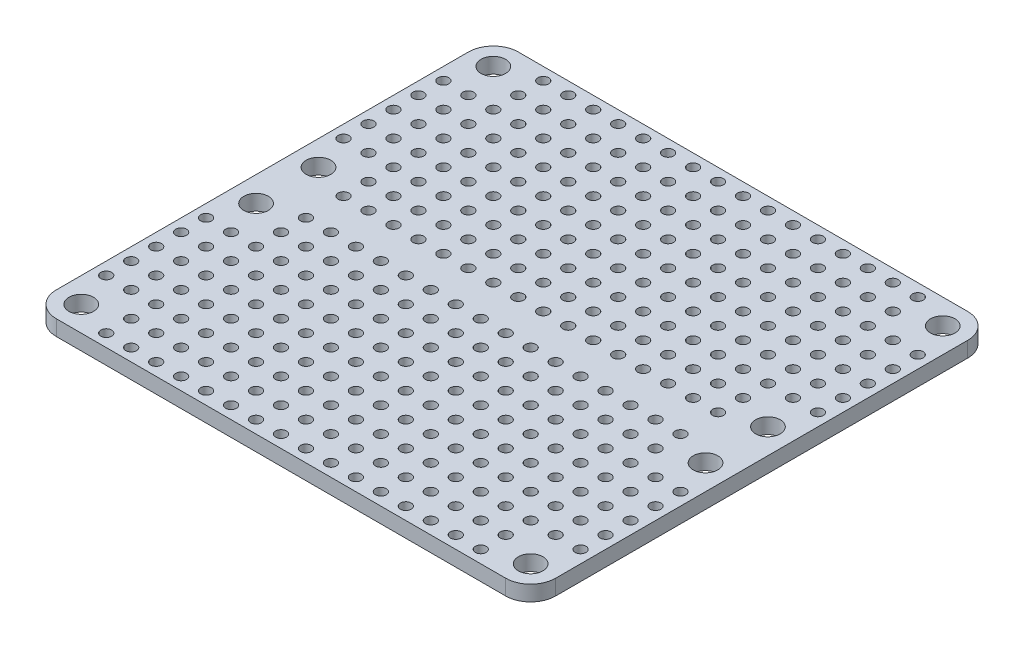
from build123d import *

# Parameters (mm, degrees)
SKETCH1_W               = 50.8
SKETCH1_H               = 47
SKETCH1_R               = 1.25
BOSS_EXTRUDE1_DEPTH     = 1.57
SKETCH4_R               = 0.55
CUT_EXTRUDE2_DEPTH      = 70.225030878
MIRROR2_COPY_1_SKETCH_R = 0.55
MIRROR2_COPY_1_DEPTH    = 70.225030878
FILLET1_R               = 2.54


with BuildPart() as part:
    # Sketch1 → Boss-Extrude1 (new body)
    with BuildSketch(Plane(origin=(0, 0, 0), x_dir=(1, 0, 0), z_dir=(0, 1, 0))):
        with Locations((25.4, 23.5)):
            Rectangle(SKETCH1_W, SKETCH1_H)
        with Locations((2.54, 44.46)):
            Circle(SKETCH1_R, mode=Mode.SUBTRACT)
        with Locations((2.54, 26.675)):
            Circle(SKETCH1_R, mode=Mode.SUBTRACT)
        with Locations((48.26, 26.675)):
            Circle(SKETCH1_R, mode=Mode.SUBTRACT)
        with Locations((48.26, 44.46)):
            Circle(SKETCH1_R, mode=Mode.SUBTRACT)
        with Locations((48.26, 20.325)):
            Circle(SKETCH1_R, mode=Mode.SUBTRACT)
        with Locations((48.26, 2.54)):
            Circle(SKETCH1_R, mode=Mode.SUBTRACT)
        with Locations((2.54, 2.54)):
            Circle(SKETCH1_R, mode=Mode.SUBTRACT)
        with Locations((2.54, 20.325)):
            Circle(SKETCH1_R, mode=Mode.SUBTRACT)
    extrude(amount=BOSS_EXTRUDE1_DEPTH)

    # Sketch4 → Cut-Extrude2 (cut, through all)
    with BuildSketch(Plane(origin=(0, 0, 0), x_dir=(1, 0, 0), z_dir=(0, 1, 0))):
        with Locations((6.35, 45.73)):
            Circle(SKETCH4_R)
        with Locations((8.89, 45.73)):
            Circle(SKETCH4_R)
        with Locations((11.43, 45.73)):
            Circle(SKETCH4_R)
        with Locations((13.97, 45.73)):
            Circle(SKETCH4_R)
        with Locations((16.51, 45.73)):
            Circle(SKETCH4_R)
        with Locations((19.05, 45.73)):
            Circle(SKETCH4_R)
        with Locations((21.59, 45.73)):
            Circle(SKETCH4_R)
        with Locations((24.13, 45.73)):
            Circle(SKETCH4_R)
        with Locations((6.35, 43.19)):
            Circle(SKETCH4_R)
        with Locations((8.89, 43.19)):
            Circle(SKETCH4_R)
        with Locations((11.43, 43.19)):
            Circle(SKETCH4_R)
        with Locations((13.97, 43.19)):
            Circle(SKETCH4_R)
        with Locations((16.51, 43.19)):
            Circle(SKETCH4_R)
        with Locations((19.05, 43.19)):
            Circle(SKETCH4_R)
        with Locations((21.59, 43.19)):
            Circle(SKETCH4_R)
        with Locations((24.13, 43.19)):
            Circle(SKETCH4_R)
        with Locations((6.35, 40.65)):
            Circle(SKETCH4_R)
        with Locations((8.89, 40.65)):
            Circle(SKETCH4_R)
        with Locations((11.43, 40.65)):
            Circle(SKETCH4_R)
        with Locations((13.97, 40.65)):
            Circle(SKETCH4_R)
        with Locations((16.51, 40.65)):
            Circle(SKETCH4_R)
        with Locations((19.05, 40.65)):
            Circle(SKETCH4_R)
        with Locations((21.59, 40.65)):
            Circle(SKETCH4_R)
        with Locations((24.13, 40.65)):
            Circle(SKETCH4_R)
        with Locations((6.35, 38.11)):
            Circle(SKETCH4_R)
        with Locations((8.89, 38.11)):
            Circle(SKETCH4_R)
        with Locations((11.43, 38.11)):
            Circle(SKETCH4_R)
        with Locations((13.97, 38.11)):
            Circle(SKETCH4_R)
        with Locations((16.51, 38.11)):
            Circle(SKETCH4_R)
        with Locations((19.05, 38.11)):
            Circle(SKETCH4_R)
        with Locations((21.59, 38.11)):
            Circle(SKETCH4_R)
        with Locations((24.13, 38.11)):
            Circle(SKETCH4_R)
        with Locations((6.35, 35.57)):
            Circle(SKETCH4_R)
        with Locations((8.89, 35.57)):
            Circle(SKETCH4_R)
        with Locations((11.43, 35.57)):
            Circle(SKETCH4_R)
        with Locations((13.97, 35.57)):
            Circle(SKETCH4_R)
        with Locations((16.51, 35.57)):
            Circle(SKETCH4_R)
        with Locations((19.05, 35.57)):
            Circle(SKETCH4_R)
        with Locations((21.59, 35.57)):
            Circle(SKETCH4_R)
        with Locations((24.13, 35.57)):
            Circle(SKETCH4_R)
        with Locations((6.35, 33.03)):
            Circle(SKETCH4_R)
        with Locations((8.89, 33.03)):
            Circle(SKETCH4_R)
        with Locations((11.43, 33.03)):
            Circle(SKETCH4_R)
        with Locations((13.97, 33.03)):
            Circle(SKETCH4_R)
        with Locations((16.51, 33.03)):
            Circle(SKETCH4_R)
        with Locations((19.05, 33.03)):
            Circle(SKETCH4_R)
        with Locations((21.59, 33.03)):
            Circle(SKETCH4_R)
        with Locations((24.13, 33.03)):
            Circle(SKETCH4_R)
        with Locations((6.35, 30.49)):
            Circle(SKETCH4_R)
        with Locations((8.89, 30.49)):
            Circle(SKETCH4_R)
        with Locations((11.43, 30.49)):
            Circle(SKETCH4_R)
        with Locations((13.97, 30.49)):
            Circle(SKETCH4_R)
        with Locations((16.51, 30.49)):
            Circle(SKETCH4_R)
        with Locations((19.05, 30.49)):
            Circle(SKETCH4_R)
        with Locations((21.59, 30.49)):
            Circle(SKETCH4_R)
        with Locations((24.13, 30.49)):
            Circle(SKETCH4_R)
        with Locations((6.35, 27.95)):
            Circle(SKETCH4_R)
        with Locations((8.89, 27.95)):
            Circle(SKETCH4_R)
        with Locations((11.43, 27.95)):
            Circle(SKETCH4_R)
        with Locations((13.97, 27.95)):
            Circle(SKETCH4_R)
        with Locations((16.51, 27.95)):
            Circle(SKETCH4_R)
        with Locations((19.05, 27.95)):
            Circle(SKETCH4_R)
        with Locations((21.59, 27.95)):
            Circle(SKETCH4_R)
        with Locations((24.13, 27.95)):
            Circle(SKETCH4_R)
        with Locations((6.35, 25.41)):
            Circle(SKETCH4_R)
        with Locations((8.89, 25.41)):
            Circle(SKETCH4_R)
        with Locations((11.43, 25.41)):
            Circle(SKETCH4_R)
        with Locations((13.97, 25.41)):
            Circle(SKETCH4_R)
        with Locations((16.51, 25.41)):
            Circle(SKETCH4_R)
        with Locations((19.05, 25.41)):
            Circle(SKETCH4_R)
        with Locations((21.59, 25.41)):
            Circle(SKETCH4_R)
        with Locations((24.13, 25.41)):
            Circle(SKETCH4_R)
        with Locations((3.81, 40.65)):
            Circle(SKETCH4_R)
        with Locations((3.81, 38.11)):
            Circle(SKETCH4_R)
        with Locations((3.81, 35.57)):
            Circle(SKETCH4_R)
        with Locations((3.81, 33.03)):
            Circle(SKETCH4_R)
        with Locations((3.81, 30.49)):
            Circle(SKETCH4_R)
        with Locations((1.27, 40.65)):
            Circle(SKETCH4_R)
        with Locations((1.27, 38.11)):
            Circle(SKETCH4_R)
        with Locations((1.27, 35.57)):
            Circle(SKETCH4_R)
        with Locations((1.27, 33.03)):
            Circle(SKETCH4_R)
        with Locations((1.27, 30.49)):
            Circle(SKETCH4_R)
    cut_extrude2 = extrude(amount=CUT_EXTRUDE2_DEPTH, mode=Mode.SUBTRACT)

    # Mirror1: Cut-Extrude2 across plane
    add(cut_extrude2.mirror(Plane.ZY.offset(-25.4)), mode=Mode.SUBTRACT)

    # Mirror2: Cut-Extrude2 across plane
    add(cut_extrude2.mirror(Plane.XY.offset(-23.5)), mode=Mode.SUBTRACT)

    # Mirror2 copy 1 sketch → Mirror2 copy 1 (cut, through all)
    with BuildSketch(Plane(origin=(50.8, 0, -47), x_dir=(-1, 0, 0), z_dir=(0, 1, 0))):
        with Locations((6.35, 45.73)):
            Circle(MIRROR2_COPY_1_SKETCH_R)
        with Locations((8.89, 45.73)):
            Circle(MIRROR2_COPY_1_SKETCH_R)
        with Locations((11.43, 45.73)):
            Circle(MIRROR2_COPY_1_SKETCH_R)
        with Locations((13.97, 45.73)):
            Circle(MIRROR2_COPY_1_SKETCH_R)
        with Locations((16.51, 45.73)):
            Circle(MIRROR2_COPY_1_SKETCH_R)
        with Locations((19.05, 45.73)):
            Circle(MIRROR2_COPY_1_SKETCH_R)
        with Locations((21.59, 45.73)):
            Circle(MIRROR2_COPY_1_SKETCH_R)
        with Locations((24.13, 45.73)):
            Circle(MIRROR2_COPY_1_SKETCH_R)
        with Locations((6.35, 43.19)):
            Circle(MIRROR2_COPY_1_SKETCH_R)
        with Locations((8.89, 43.19)):
            Circle(MIRROR2_COPY_1_SKETCH_R)
        with Locations((11.43, 43.19)):
            Circle(MIRROR2_COPY_1_SKETCH_R)
        with Locations((13.97, 43.19)):
            Circle(MIRROR2_COPY_1_SKETCH_R)
        with Locations((16.51, 43.19)):
            Circle(MIRROR2_COPY_1_SKETCH_R)
        with Locations((19.05, 43.19)):
            Circle(MIRROR2_COPY_1_SKETCH_R)
        with Locations((21.59, 43.19)):
            Circle(MIRROR2_COPY_1_SKETCH_R)
        with Locations((24.13, 43.19)):
            Circle(MIRROR2_COPY_1_SKETCH_R)
        with Locations((6.35, 40.65)):
            Circle(MIRROR2_COPY_1_SKETCH_R)
        with Locations((8.89, 40.65)):
            Circle(MIRROR2_COPY_1_SKETCH_R)
        with Locations((11.43, 40.65)):
            Circle(MIRROR2_COPY_1_SKETCH_R)
        with Locations((13.97, 40.65)):
            Circle(MIRROR2_COPY_1_SKETCH_R)
        with Locations((16.51, 40.65)):
            Circle(MIRROR2_COPY_1_SKETCH_R)
        with Locations((19.05, 40.65)):
            Circle(MIRROR2_COPY_1_SKETCH_R)
        with Locations((21.59, 40.65)):
            Circle(MIRROR2_COPY_1_SKETCH_R)
        with Locations((24.13, 40.65)):
            Circle(MIRROR2_COPY_1_SKETCH_R)
        with Locations((6.35, 38.11)):
            Circle(MIRROR2_COPY_1_SKETCH_R)
        with Locations((8.89, 38.11)):
            Circle(MIRROR2_COPY_1_SKETCH_R)
        with Locations((11.43, 38.11)):
            Circle(MIRROR2_COPY_1_SKETCH_R)
        with Locations((13.97, 38.11)):
            Circle(MIRROR2_COPY_1_SKETCH_R)
        with Locations((16.51, 38.11)):
            Circle(MIRROR2_COPY_1_SKETCH_R)
        with Locations((19.05, 38.11)):
            Circle(MIRROR2_COPY_1_SKETCH_R)
        with Locations((21.59, 38.11)):
            Circle(MIRROR2_COPY_1_SKETCH_R)
        with Locations((24.13, 38.11)):
            Circle(MIRROR2_COPY_1_SKETCH_R)
        with Locations((6.35, 35.57)):
            Circle(MIRROR2_COPY_1_SKETCH_R)
        with Locations((8.89, 35.57)):
            Circle(MIRROR2_COPY_1_SKETCH_R)
        with Locations((11.43, 35.57)):
            Circle(MIRROR2_COPY_1_SKETCH_R)
        with Locations((13.97, 35.57)):
            Circle(MIRROR2_COPY_1_SKETCH_R)
        with Locations((16.51, 35.57)):
            Circle(MIRROR2_COPY_1_SKETCH_R)
        with Locations((19.05, 35.57)):
            Circle(MIRROR2_COPY_1_SKETCH_R)
        with Locations((21.59, 35.57)):
            Circle(MIRROR2_COPY_1_SKETCH_R)
        with Locations((24.13, 35.57)):
            Circle(MIRROR2_COPY_1_SKETCH_R)
        with Locations((6.35, 33.03)):
            Circle(MIRROR2_COPY_1_SKETCH_R)
        with Locations((8.89, 33.03)):
            Circle(MIRROR2_COPY_1_SKETCH_R)
        with Locations((11.43, 33.03)):
            Circle(MIRROR2_COPY_1_SKETCH_R)
        with Locations((13.97, 33.03)):
            Circle(MIRROR2_COPY_1_SKETCH_R)
        with Locations((16.51, 33.03)):
            Circle(MIRROR2_COPY_1_SKETCH_R)
        with Locations((19.05, 33.03)):
            Circle(MIRROR2_COPY_1_SKETCH_R)
        with Locations((21.59, 33.03)):
            Circle(MIRROR2_COPY_1_SKETCH_R)
        with Locations((24.13, 33.03)):
            Circle(MIRROR2_COPY_1_SKETCH_R)
        with Locations((6.35, 30.49)):
            Circle(MIRROR2_COPY_1_SKETCH_R)
        with Locations((8.89, 30.49)):
            Circle(MIRROR2_COPY_1_SKETCH_R)
        with Locations((11.43, 30.49)):
            Circle(MIRROR2_COPY_1_SKETCH_R)
        with Locations((13.97, 30.49)):
            Circle(MIRROR2_COPY_1_SKETCH_R)
        with Locations((16.51, 30.49)):
            Circle(MIRROR2_COPY_1_SKETCH_R)
        with Locations((19.05, 30.49)):
            Circle(MIRROR2_COPY_1_SKETCH_R)
        with Locations((21.59, 30.49)):
            Circle(MIRROR2_COPY_1_SKETCH_R)
        with Locations((24.13, 30.49)):
            Circle(MIRROR2_COPY_1_SKETCH_R)
        with Locations((6.35, 27.95)):
            Circle(MIRROR2_COPY_1_SKETCH_R)
        with Locations((8.89, 27.95)):
            Circle(MIRROR2_COPY_1_SKETCH_R)
        with Locations((11.43, 27.95)):
            Circle(MIRROR2_COPY_1_SKETCH_R)
        with Locations((13.97, 27.95)):
            Circle(MIRROR2_COPY_1_SKETCH_R)
        with Locations((16.51, 27.95)):
            Circle(MIRROR2_COPY_1_SKETCH_R)
        with Locations((19.05, 27.95)):
            Circle(MIRROR2_COPY_1_SKETCH_R)
        with Locations((21.59, 27.95)):
            Circle(MIRROR2_COPY_1_SKETCH_R)
        with Locations((24.13, 27.95)):
            Circle(MIRROR2_COPY_1_SKETCH_R)
        with Locations((6.35, 25.41)):
            Circle(MIRROR2_COPY_1_SKETCH_R)
        with Locations((8.89, 25.41)):
            Circle(MIRROR2_COPY_1_SKETCH_R)
        with Locations((11.43, 25.41)):
            Circle(MIRROR2_COPY_1_SKETCH_R)
        with Locations((13.97, 25.41)):
            Circle(MIRROR2_COPY_1_SKETCH_R)
        with Locations((16.51, 25.41)):
            Circle(MIRROR2_COPY_1_SKETCH_R)
        with Locations((19.05, 25.41)):
            Circle(MIRROR2_COPY_1_SKETCH_R)
        with Locations((21.59, 25.41)):
            Circle(MIRROR2_COPY_1_SKETCH_R)
        with Locations((24.13, 25.41)):
            Circle(MIRROR2_COPY_1_SKETCH_R)
        with Locations((3.81, 40.65)):
            Circle(MIRROR2_COPY_1_SKETCH_R)
        with Locations((3.81, 38.11)):
            Circle(MIRROR2_COPY_1_SKETCH_R)
        with Locations((3.81, 35.57)):
            Circle(MIRROR2_COPY_1_SKETCH_R)
        with Locations((3.81, 33.03)):
            Circle(MIRROR2_COPY_1_SKETCH_R)
        with Locations((3.81, 30.49)):
            Circle(MIRROR2_COPY_1_SKETCH_R)
        with Locations((1.27, 40.65)):
            Circle(MIRROR2_COPY_1_SKETCH_R)
        with Locations((1.27, 38.11)):
            Circle(MIRROR2_COPY_1_SKETCH_R)
        with Locations((1.27, 35.57)):
            Circle(MIRROR2_COPY_1_SKETCH_R)
        with Locations((1.27, 33.03)):
            Circle(MIRROR2_COPY_1_SKETCH_R)
        with Locations((1.27, 30.49)):
            Circle(MIRROR2_COPY_1_SKETCH_R)
    extrude(amount=MIRROR2_COPY_1_DEPTH, mode=Mode.SUBTRACT)

    # Fillet1
    fillet1_edges = [part.edges().sort_by_distance(p)[0] for p in [
        (50.8, 0.785, 0),
        (0, 0.785, 0),
        (0, 0.785, -47),
        (50.8, 0.785, -47),
    ]]
    fillet(fillet1_edges, radius=FILLET1_R)


solid = part.part
